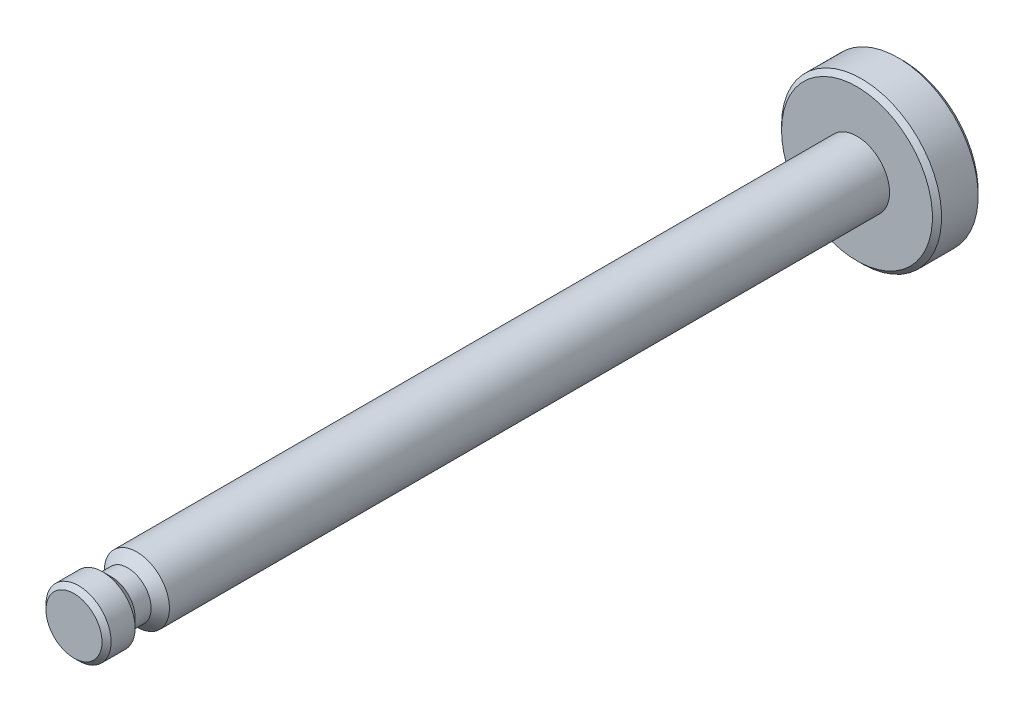
from build123d import *

# Parameters (mm, degrees)
SKETCH2_R   = 1.425
SHAFT_DEPTH = 34.25
SKETCH3_R   = 3.5
HEAD_DEPTH  = 2
DEBURS_SIZE = 0.2


with BuildPart() as part:
    # Sketch2 → Shaft (new body)
    with BuildSketch(Plane.XY):
        Circle(SKETCH2_R)
    extrude(amount=SHAFT_DEPTH)

    # Sketch3 → Head (add)
    with BuildSketch(Plane(origin=(0, 0, 0), x_dir=(-1, 0, 0), z_dir=(0, 0, -1))):
        Circle(SKETCH3_R)
    extrude(amount=HEAD_DEPTH)

    # Sketch4 → e-Clip Notch (revolve, cut)
    with BuildSketch(Plane(origin=(0, 0, 0), x_dir=(0, 0, -1), z_dir=(1, 0, 0))):
        Polygon((-33, 1.425), (-31.5, 1.425), (-31.9, 1.025), (-32.6, 1.025), align=None)
    revolve(axis=Axis((0, 0, 0), (0, 0, 1)), mode=Mode.SUBTRACT)

    # Deburs
    deburs_edges = [part.edges().sort_by_distance(p)[0] for p in [
        (-1.425, 0, 34.25),
        (3.5, 0, 0),
        (3.5, 0, -2),
    ]]
    chamfer(deburs_edges, length=DEBURS_SIZE)


solid = part.part
